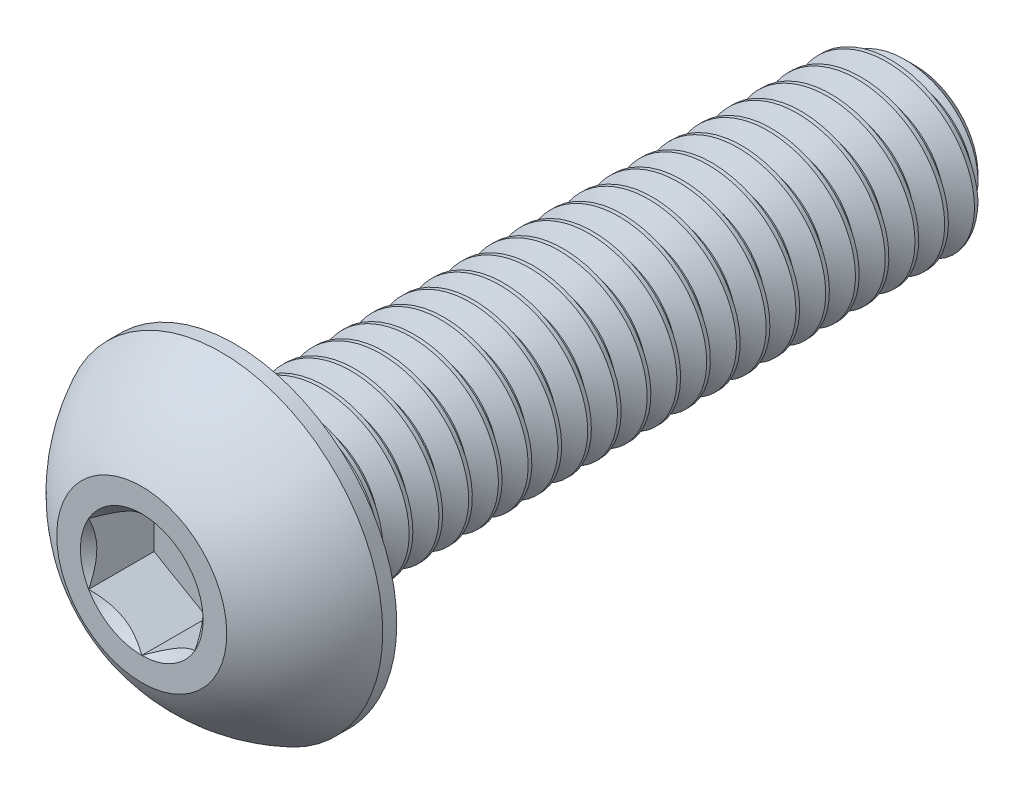
from build123d import *

# Parameters (mm, degrees)
SKETCH1_W          = 16
SKETCH1_H          = 2
CHAMFER1_SIZE      = 0.525
CUT_SWEEP1_PITCH   = 0.7
CUT_EXTRUDE2_DEPTH = 1.54


with BuildPart() as part:
    # Sketch1 → Revolve1 (revolve)
    with BuildSketch(Plane(origin=(0, 0, 0), x_dir=(0, 0, -1), z_dir=(1, 0, 0))):
        with Locations((10.2, 1)):
            Rectangle(SKETCH1_W, SKETCH1_H)
    revolve(axis=Axis((0, 0, -18.2), (0, 0, 1)))

    # Chamfer1
    chamfer1_edges = [part.edges().sort_by_distance(p)[0] for p in [
        (0, -2, -18.2),
    ]]
    chamfer(chamfer1_edges, length=CHAMFER1_SIZE)

    # Cut-Sweep1: the profile of Sketch2 profile screwed along a right-hand helix of 26 turns, 6 arcs to a turn; built about Z, then put on its axis
    cut_sweep1_z = Axis((0, 0, 0), (0, 0, 1))
    cut_sweep1_corners = [(2.0003, 0, 0.000173205), (2.0003, 0, -0.612673205), (1.545336663, 0, -0.35), (1.545336663, 0, -0.2625)]
    with BuildLine(mode=Mode.PRIVATE) as cut_sweep1_profile:
        Line(cut_sweep1_corners[0], cut_sweep1_corners[1])
        Line(cut_sweep1_corners[1], cut_sweep1_corners[2])
        Line(cut_sweep1_corners[2], cut_sweep1_corners[3])
        Line(cut_sweep1_corners[3], cut_sweep1_corners[0])
    cut_sweep1_cap = Face(cut_sweep1_profile.wire())
    cut_sweep1_turn_angles = [0, 30, 60, 90, 120, 150, 180, 210, 240, 270, 300, 330, 360]
    cut_sweep1_turn_weights = [1, 0.8660254037844387, 1, 0.8660254037844387, 1, 0.8660254037844387, 1, 0.8660254037844387, 1, 0.8660254037844387, 1, 0.8660254037844387, 1]
    cut_sweep1_turn_rails = [Edge.make_bspline([Vector(p[0], p[1], 0).rotate(cut_sweep1_z, cut_sweep1_turn_angles[k]) / cut_sweep1_turn_weights[k] + Vector(0, 0, p[2] + CUT_SWEEP1_PITCH * cut_sweep1_turn_angles[k] / 360) for k in range(13)], [0, 0, 0, 1, 1, 2, 2, 3, 3, 4, 4, 5, 5, 6, 6, 6], 2, cut_sweep1_turn_weights) for p in cut_sweep1_corners]
    cut_sweep1_turn_sides = [Face.make_surface_from_curves(cut_sweep1_turn_rails[p[0]], cut_sweep1_turn_rails[p[1]]) for p in [(0, 1), (1, 2), (2, 3), (3, 0)]]
    cut_sweep1 = Plane(origin=(0, 0, -18.2), x_dir=(0, 1, 0), z_dir=(0, 0, 1)) * Solid(Shell([*[p.moved(Location((0, 0, CUT_SWEEP1_PITCH * i))) for i in range(26) for p in cut_sweep1_turn_sides], cut_sweep1_cap, cut_sweep1_cap.rotate(cut_sweep1_z, 9360).moved(Location((0, 0, CUT_SWEEP1_PITCH * 9360 / 360)))]))
    add(cut_sweep1, mode=Mode.SUBTRACT)

    # Sketch7 → Revolve2 (revolve)
    with BuildSketch(Plane(origin=(0, 0, 0), x_dir=(0, 0, -1), z_dir=(1, 0, 0)), mode=Mode.PRIVATE) as revolve2_sk:
        with BuildLine():
            Line((1.87, 3.8), (2.2, 3.8))
            Line((2.2, 3.8), (2.2, 0))
            Line((2.2, 0), (0, 0))
            Line((0, 0), (0, 2))
            ThreePointArc((0, 2), (0.793500147, 3.047002626), (1.87, 3.8))
        make_face()
    revolve(revolve2_sk.sketch.rotate(Axis((0, 0, 0), (0, 0, -1)), 189.336081704), axis=Axis((0, 0, 0), (0, 0, -1)))

    # Sketch5 → Cut-Extrude2 (cut)
    with BuildSketch(Plane.XY):
        Polygon((1.25, -0.721687836), (1.25, 0.721687836), (0, 1.443375673), (-1.25, 0.721687836), (-1.25, -0.721687836), (0, -1.443375673), align=None)
    extrude(amount=-CUT_EXTRUDE2_DEPTH, mode=Mode.SUBTRACT)

    # Cut-Extrude3 cone 1 section (through the dimple's axis) → Cut-Extrude3 (revolve, cut)
    with BuildSketch(Plane(origin=(0, 0, 0), x_dir=(0, -1, 0), z_dir=(1, 0, 0))):
        Polygon((0, 0), (1.443375673, 0), (0, 1.443375673), align=None)
    revolve(axis=Axis((0, 0, 0), (0, 0, -1)), mode=Mode.SUBTRACT)


solid = part.part
